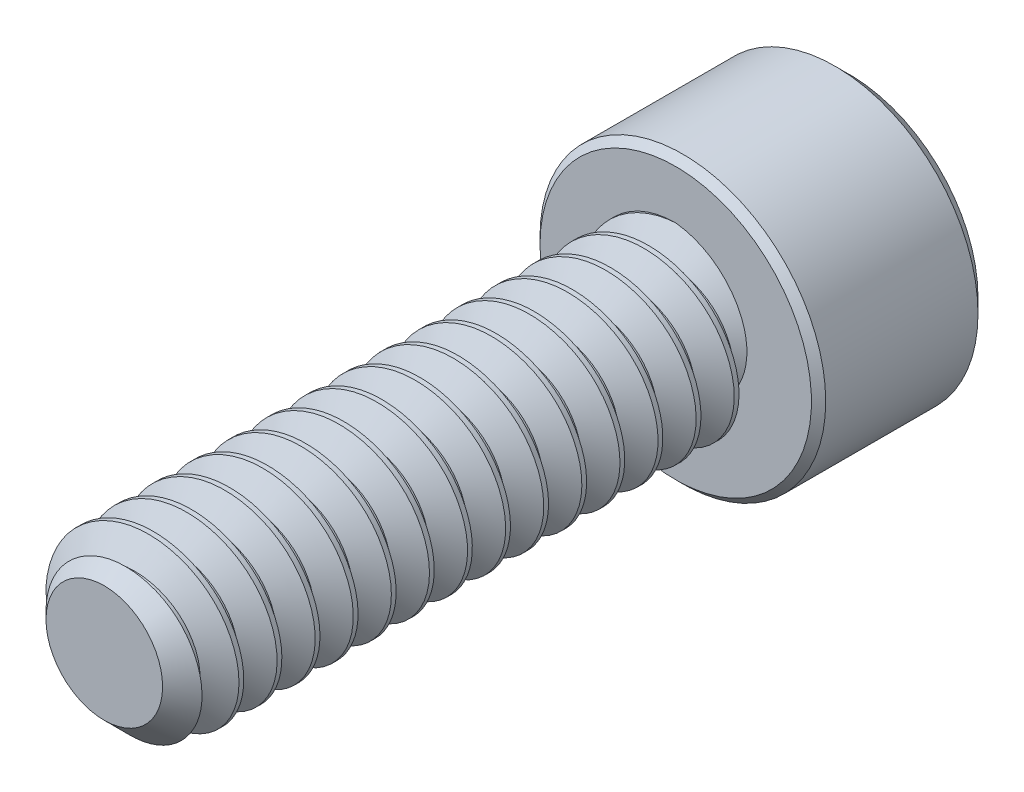
from build123d import *

# Parameters (mm, degrees)
SKETCH1_R          = 2.413
EXTRUDE1_DEPTH     = 15.875
CHAMFER3_SIZE      = 0.79375
CUT_SWEEP1_PITCH   = 1.058333333
SKETCH6_R          = 3.96875
EXTRUDE2_DEPTH     = 4.826
CUT_EXTRUDE1_DEPTH = 2.9765625
CHAMFER1_SIZE      = 0.396875
CHAMFER2_SIZE      = 0.1984375


with BuildPart() as part:
    # Sketch1 → Extrude1 (new body)
    with BuildSketch(Plane.XY):
        Circle(SKETCH1_R)
    extrude(amount=-EXTRUDE1_DEPTH)

    # Chamfer3
    chamfer3_edges = [part.edges().sort_by_distance(p)[0] for p in [
        (-2.413, 0, 0),
    ]]
    chamfer(chamfer3_edges, length=CHAMFER3_SIZE)

    # Cut-Sweep1: the profile of Sketch3 profile screwed along a right-hand helix of 16 turns, 6 arcs to a turn; built about Z, then put on its axis
    cut_sweep1_z = Axis((0, 0, 0), (0, 0, 1))
    cut_sweep1_corners = [(2.4133, 0, -0.926214872), (1.725592336, 0, -0.529166667), (1.725592336, 0, -0.396875), (2.4133, 0, 0.000173205)]
    with BuildLine(mode=Mode.PRIVATE) as cut_sweep1_profile:
        Line(cut_sweep1_corners[0], cut_sweep1_corners[1])
        Line(cut_sweep1_corners[1], cut_sweep1_corners[2])
        Line(cut_sweep1_corners[2], cut_sweep1_corners[3])
        Line(cut_sweep1_corners[3], cut_sweep1_corners[0])
    cut_sweep1_cap = Face(cut_sweep1_profile.wire())
    cut_sweep1_turn_angles = [0, 30, 60, 90, 120, 150, 180, 210, 240, 270, 300, 330, 360]
    cut_sweep1_turn_weights = [1, 0.8660254037844387, 1, 0.8660254037844387, 1, 0.8660254037844387, 1, 0.8660254037844387, 1, 0.8660254037844387, 1, 0.8660254037844387, 1]
    cut_sweep1_turn_rails = [Edge.make_bspline([Vector(p[0], p[1], 0).rotate(cut_sweep1_z, cut_sweep1_turn_angles[k]) / cut_sweep1_turn_weights[k] + Vector(0, 0, p[2] + CUT_SWEEP1_PITCH * cut_sweep1_turn_angles[k] / 360) for k in range(13)], [0, 0, 0, 1, 1, 2, 2, 3, 3, 4, 4, 5, 5, 6, 6, 6], 2, cut_sweep1_turn_weights) for p in cut_sweep1_corners]
    cut_sweep1_turn_sides = [Face.make_surface_from_curves(cut_sweep1_turn_rails[p[0]], cut_sweep1_turn_rails[p[1]]) for p in [(0, 1), (1, 2), (2, 3), (3, 0)]]
    cut_sweep1 = Plane(origin=(0, 0, 0), x_dir=(0, 1, 0), z_dir=(0, 0, -1)) * Solid(Shell([*[p.moved(Location((0, 0, CUT_SWEEP1_PITCH * i))) for i in range(16) for p in cut_sweep1_turn_sides], cut_sweep1_cap, cut_sweep1_cap.rotate(cut_sweep1_z, 5760).moved(Location((0, 0, CUT_SWEEP1_PITCH * 5760 / 360)))]))
    add(cut_sweep1, mode=Mode.SUBTRACT)

    # Sketch6 → Extrude2 (add)
    with BuildSketch(Plane(origin=(0, 0, -15.875), x_dir=(-1, 0, 0), z_dir=(0, 0, -1))):
        Circle(SKETCH6_R)
    extrude(amount=EXTRUDE2_DEPTH)

    # Sketch7 → Cut-Extrude1 (cut)
    with BuildSketch(Plane(origin=(0, 0, -20.701), x_dir=(-1, 0, 0), z_dir=(0, 0, -1))):
        Polygon((0, 2.291358881), (-1.984375, 1.14567944), (-1.984375, -1.14567944), (0, -2.291358881), (1.984375, -1.14567944), (1.984375, 1.14567944), align=None)
    extrude(amount=-CUT_EXTRUDE1_DEPTH, mode=Mode.SUBTRACT)

    # Cut-Extrude2 cone 1 section (through the dimple's axis) → Cut-Extrude2 (revolve, cut)
    with BuildSketch(Plane(origin=(0, 0, -20.701), x_dir=(0, 1, 0), z_dir=(1, 0, 0))):
        Polygon((0, 0), (2.291358881, 0), (0, 2.291358881), align=None)
    revolve(axis=Axis((0, 0, -20.701), (0, 0, 1)), mode=Mode.SUBTRACT)

    # Chamfer1
    chamfer1_edges = [part.edges().sort_by_distance(p)[0] for p in [
        (3.96875, 0, -20.701),
    ]]
    chamfer(chamfer1_edges, length=CHAMFER1_SIZE)

    # Chamfer2
    chamfer2_edges = [part.edges().sort_by_distance(p)[0] for p in [
        (3.96875, 0, -15.875),
    ]]
    chamfer(chamfer2_edges, length=CHAMFER2_SIZE)


solid = part.part
